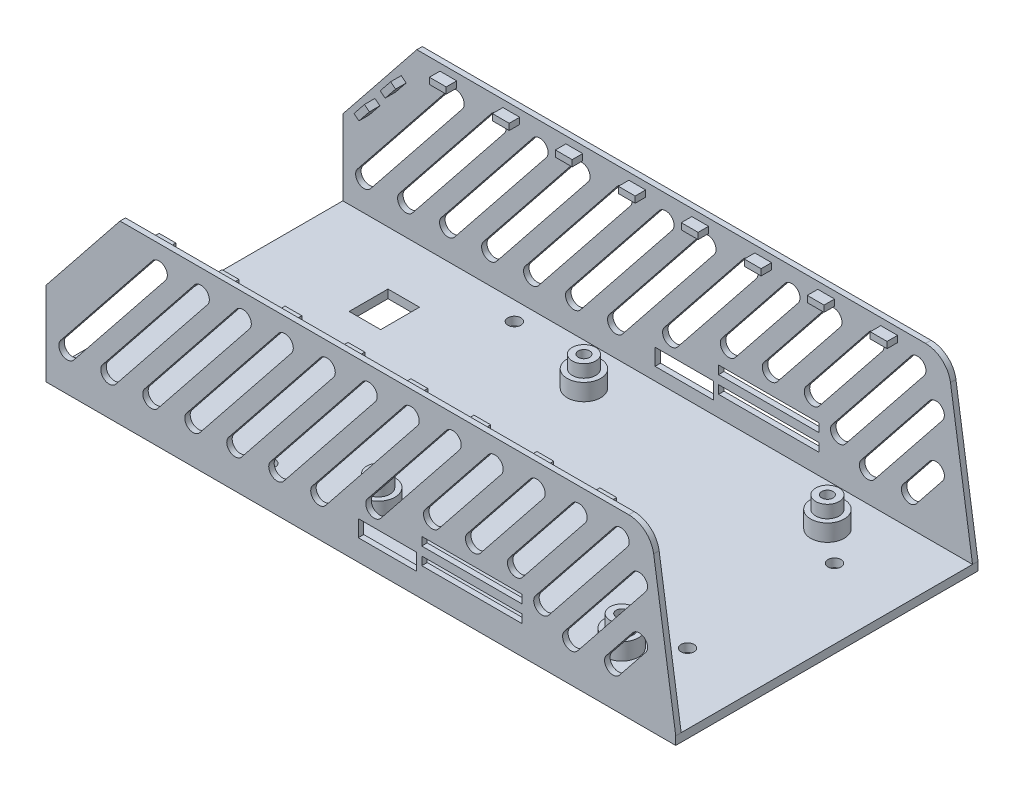
from build123d import *

# Parameters (mm, degrees)
SKETCH_1_W               = 150
SKETCH_1_H               = 72
EXTRUDE_353_DEPTH        = 2
SKETCH_2_R               = 4
EXTRUDE_552_DEPTH        = 7
CUT_EXTRUDE_M2_5_DEPTH   = 5
CUT_EXTRUDE_M2_5_2_REACH = 135.916
SKETCH_4_R               = 1.35
CUT_EXTRUDE_START        = -3
SKETCH_6_R               = 4
SKETCH_6_R_2             = 2.794428219
CUT_EXTRUDE_3_DEPTH      = 3
SKETCH_1271_W            = 23.879073069
SKETCH_1271_H            = 2
SKETCH_1271_W_2          = 13.873866224
SKETCH_1271_H_2          = 3.944574251
EXTRUDE_2203_DEPTH       = 1.3
SKETCH_14_W              = 4
SKETCH_14_H              = 1.5
EXTRUDE_2776_DEPTH       = 2.5
SKETCH_17_W              = 7.5
SKETCH_17_H              = 9.25
SKETCH_17_R              = 1.55
CUT_EXTRUDE_3993_DEPTH   = 2.5


with BuildPart() as part:
    # 草图1 → Extrude 353 (new body)
    with BuildSketch(Plane(origin=(0, 0, 0), x_dir=(1, 0, 0), z_dir=(0, 1, 0))):
        with Locations((36.41172395, 38.133946477)):
            Rectangle(SKETCH_1_W, SKETCH_1_H)
    extrude(amount=-EXTRUDE_353_DEPTH)

    # 草图2 → Extrude 552 (add)
    with BuildSketch(Plane(origin=(0, 0, 0), x_dir=(1, 0, 0), z_dir=(0, 1, 0))):
        with Locations((28.75484872, 13.928985193)):
            Circle(SKETCH_2_R)
        with Locations((86.75484872, 13.928985193)):
            Circle(SKETCH_2_R)
        with Locations((86.75484872, 62.928985193)):
            Circle(SKETCH_2_R)
        with Locations((28.75484872, 62.928985193)):
            Circle(SKETCH_2_R)
    extrude(amount=EXTRUDE_552_DEPTH)

    # Sketch 597 → Cut-Extrude m2.5 (cut)
    with BuildSketch(Plane.XZ.offset(2)):
        Polygon((88.785171308, -11.717396732), (85.854718224, -11.064880023), (83.824395636, -13.276468484), (84.724526132, -16.140573654), (87.654979216, -16.793090363), (89.685301804, -14.581501902), align=None)
        Polygon((30.785171308, -11.717396732), (27.854718224, -11.064880023), (25.824395636, -13.276468484), (26.724526132, -16.140573654), (29.654979216, -16.793090363), (31.685301804, -14.581501902), align=None)
        Polygon((88.785171308, -60.717396732), (85.854718224, -60.064880023), (83.824395636, -62.276468484), (84.724526132, -65.140573654), (87.654979216, -65.793090363), (89.685301804, -63.581501902), align=None)
        Polygon((30.785171308, -60.717396732), (27.854718224, -60.064880023), (25.824395636, -62.276468484), (26.724526132, -65.140573654), (29.654979216, -65.793090363), (31.685301804, -63.581501902), align=None)
    extrude(amount=-CUT_EXTRUDE_M2_5_DEPTH, mode=Mode.SUBTRACT)

    # 草图4 → Cut-Extrude m2.5 2 (cut, up to next)
    with BuildSketch(Plane.XZ.offset(-3), mode=Mode.PRIVATE) as cut_extrude_m2_5_2_sk1:
        with Locations((28.75484872, -13.928985193)):
            Circle(SKETCH_4_R)
    cut_extrude_m2_5_2_tool1 = extrude(cut_extrude_m2_5_2_sk1.sketch, amount=-CUT_EXTRUDE_M2_5_2_REACH, mode=Mode.PRIVATE) & part.part
    # 草图4 → Cut-Extrude m2.5 2 (cut, up to next)
    with BuildSketch(Plane.XZ.offset(-3), mode=Mode.PRIVATE) as cut_extrude_m2_5_2_sk2:
        with Locations((86.75484872, -13.928985193)):
            Circle(SKETCH_4_R)
    cut_extrude_m2_5_2_tool2 = extrude(cut_extrude_m2_5_2_sk2.sketch, amount=-CUT_EXTRUDE_M2_5_2_REACH, mode=Mode.PRIVATE) & part.part
    # 草图4 → Cut-Extrude m2.5 2 (cut, up to next)
    with BuildSketch(Plane.XZ.offset(-3), mode=Mode.PRIVATE) as cut_extrude_m2_5_2_sk3:
        with Locations((86.75484872, -62.928985193)):
            Circle(SKETCH_4_R)
    cut_extrude_m2_5_2_tool3 = extrude(cut_extrude_m2_5_2_sk3.sketch, amount=-CUT_EXTRUDE_M2_5_2_REACH, mode=Mode.PRIVATE) & part.part
    # 草图4 → Cut-Extrude m2.5 2 (cut, up to next)
    with BuildSketch(Plane.XZ.offset(-3), mode=Mode.PRIVATE) as cut_extrude_m2_5_2_sk4:
        with Locations((28.75484872, -62.928985193)):
            Circle(SKETCH_4_R)
    cut_extrude_m2_5_2_tool4 = extrude(cut_extrude_m2_5_2_sk4.sketch, amount=-CUT_EXTRUDE_M2_5_2_REACH, mode=Mode.PRIVATE) & part.part
    add(cut_extrude_m2_5_2_tool1.solids().sort_by_distance((28.754849, 3, -13.928985))[0], mode=Mode.SUBTRACT)
    add(cut_extrude_m2_5_2_tool2.solids().sort_by_distance((86.754849, 3, -13.928985))[0], mode=Mode.SUBTRACT)
    add(cut_extrude_m2_5_2_tool3.solids().sort_by_distance((86.754849, 3, -62.928985))[0], mode=Mode.SUBTRACT)
    add(cut_extrude_m2_5_2_tool4.solids().sort_by_distance((28.754849, 3, -62.928985))[0], mode=Mode.SUBTRACT)

    # 草图6 → 切除-拉伸3 (cut)
    # profile 1 of 4: a face of its own
    with BuildSketch(Plane(origin=(0, 7, 0), x_dir=(1, 0, 0), z_dir=(0, 1, 0)).offset(CUT_EXTRUDE_START)):
        with Locations((28.75484872, 13.928985193)):
            Circle(SKETCH_6_R)
        with Locations((28.75484872, 13.928985193)):
            Circle(SKETCH_6_R_2, mode=Mode.SUBTRACT)
    # profile 2 of 4: a face of its own
    with BuildSketch(Plane(origin=(0, 7, 0), x_dir=(1, 0, 0), z_dir=(0, 1, 0)).offset(CUT_EXTRUDE_START)):
        with Locations((86.75484872, 13.928985193)):
            Circle(SKETCH_6_R)
        with Locations((86.75484872, 13.928985193)):
            Circle(SKETCH_6_R_2, mode=Mode.SUBTRACT)
    # profile 3 of 4: a face of its own
    with BuildSketch(Plane(origin=(0, 7, 0), x_dir=(1, 0, 0), z_dir=(0, 1, 0)).offset(CUT_EXTRUDE_START)):
        with Locations((86.75484872, 62.928985193)):
            Circle(SKETCH_6_R)
        with Locations((86.75484872, 62.928985193)):
            Circle(SKETCH_6_R_2, mode=Mode.SUBTRACT)
    # profile 4 of 4: a face of its own
    with BuildSketch(Plane(origin=(0, 7, 0), x_dir=(1, 0, 0), z_dir=(0, 1, 0)).offset(CUT_EXTRUDE_START)):
        with Locations((28.75484872, 62.928985193)):
            Circle(SKETCH_6_R)
        with Locations((28.75484872, 62.928985193)):
            Circle(SKETCH_6_R_2, mode=Mode.SUBTRACT)
    extrude(amount=CUT_EXTRUDE_3_DEPTH, mode=Mode.SUBTRACT)

    # Sketch 1271 → Extrude 2203 (add)
    with BuildSketch(Plane(origin=(0, 0, -74.133946477), x_dir=(-1, 0, 0), z_dir=(0, 0, -1))):
        with BuildLine():
            Line((-111.41172395, 0), (38.58827605, 0))
            Line((38.58827605, 0), (38.58827605, 17.944664202))
            Line((38.58827605, 17.944664202), (20.958907586, 40))
            Line((20.958907586, 40), (-100.225410385, 40))
            ThreePointArc((-100.225410385, 40), (-104.139525694, 38.547493963), (-106.158548965, 34.893233782))
            Line((-106.158548965, 34.893233782), (-111.41172395, 0))
        make_face()
        with Locations((-62.854810914, 5.838076596)):
            Rectangle(SKETCH_1271_W, SKETCH_1271_H, mode=Mode.SUBTRACT)
        with Locations((-62.854810914, 9.895875112)):
            Rectangle(SKETCH_1271_W, SKETCH_1271_H, mode=Mode.SUBTRACT)
        with Locations((-42.731701964, 5.027712875)):
            Rectangle(SKETCH_1271_W_2, SKETCH_1271_H_2, mode=Mode.SUBTRACT)
        with BuildLine():
            Line((31.975272266, 5.823111001), (10.122209654, 33.162526768))
            ThreePointArc((10.122209654, 33.162526768), (10.435715549, 35.973525532), (13.246714313, 35.660019638))
            Line((13.246714313, 35.660019638), (35.099776925, 8.320603871))
            ThreePointArc((35.099776925, 8.320603871), (34.786271031, 5.509605106), (31.975272266, 5.823111001))
        make_face(mode=Mode.SUBTRACT)
        with BuildLine():
            Line((21.975272266, 5.823111001), (0.122209654, 33.162526768))
            ThreePointArc((0.122209654, 33.162526768), (0.435715549, 35.973525532), (3.246714313, 35.660019638))
            Line((3.246714313, 35.660019638), (25.099776925, 8.320603871))
            ThreePointArc((25.099776925, 8.320603871), (24.786271031, 5.509605106), (21.975272266, 5.823111001))
        make_face(mode=Mode.SUBTRACT)
        with BuildLine():
            Line((11.975272266, 5.823111001), (-9.877790346, 33.162526768))
            ThreePointArc((-9.877790346, 33.162526768), (-9.564284451, 35.973525532), (-6.753285687, 35.660019638))
            Line((-6.753285687, 35.660019638), (15.099776925, 8.320603871))
            ThreePointArc((15.099776925, 8.320603871), (14.786271031, 5.509605106), (11.975272266, 5.823111001))
        make_face(mode=Mode.SUBTRACT)
        with BuildLine():
            Line((1.975272266, 5.823111001), (-19.877790346, 33.162526768))
            ThreePointArc((-19.877790346, 33.162526768), (-19.564284451, 35.973525532), (-16.753285687, 35.660019638))
            Line((-16.753285687, 35.660019638), (5.099776925, 8.320603871))
            ThreePointArc((5.099776925, 8.320603871), (4.786271031, 5.509605106), (1.975272266, 5.823111001))
        make_face(mode=Mode.SUBTRACT)
        with BuildLine():
            Line((-8.024727734, 5.823111001), (-29.877790346, 33.162526768))
            ThreePointArc((-29.877790346, 33.162526768), (-29.564284451, 35.973525532), (-26.753285687, 35.660019638))
            Line((-26.753285687, 35.660019638), (-4.900223075, 8.320603871))
            ThreePointArc((-4.900223075, 8.320603871), (-5.213728969, 5.509605106), (-8.024727734, 5.823111001))
        make_face(mode=Mode.SUBTRACT)
        with BuildLine():
            Line((-18.024727734, 5.823111001), (-39.877790346, 33.162526768))
            ThreePointArc((-39.877790346, 33.162526768), (-39.564284451, 35.973525532), (-36.753285687, 35.660019638))
            Line((-36.753285687, 35.660019638), (-14.900223075, 8.320603871))
            ThreePointArc((-14.900223075, 8.320603871), (-15.213728969, 5.509605106), (-18.024727734, 5.823111001))
        make_face(mode=Mode.SUBTRACT)
        with BuildLine():
            Line((-28.024727734, 5.823111001), (-49.877790346, 33.162526768))
            ThreePointArc((-49.877790346, 33.162526768), (-49.564284451, 35.973525532), (-46.753285687, 35.660019638))
            Line((-46.753285687, 35.660019638), (-24.900223075, 8.320603871))
            ThreePointArc((-24.900223075, 8.320603871), (-25.213728969, 5.509605106), (-28.024727734, 5.823111001))
        make_face(mode=Mode.SUBTRACT)
        with BuildLine():
            Line((-41.146593821, 9.728741825), (-59.877790346, 33.162526768))
            ThreePointArc((-59.877790346, 33.162526768), (-59.564284451, 35.973525532), (-56.753285687, 35.660019638))
            Line((-56.753285687, 35.660019638), (-38.022089162, 12.226234695))
            ThreePointArc((-38.022089162, 12.226234695), (-38.335595057, 9.41523593), (-41.146593821, 9.728741825))
        make_face(mode=Mode.SUBTRACT)
        with BuildLine():
            Line((-54.892833126, 14.415498813), (-69.877790346, 33.162526768))
            ThreePointArc((-69.877790346, 33.162526768), (-69.564284451, 35.973525532), (-66.753285687, 35.660019638))
            Line((-66.753285687, 35.660019638), (-51.768328467, 16.912991683))
            ThreePointArc((-51.768328467, 16.912991683), (-52.081834362, 14.101992919), (-54.892833126, 14.415498813))
        make_face(mode=Mode.SUBTRACT)
        with BuildLine():
            Line((-64.892833126, 14.415498813), (-79.877790346, 33.162526768))
            ThreePointArc((-79.877790346, 33.162526768), (-79.564284451, 35.973525532), (-76.753285687, 35.660019638))
            Line((-76.753285687, 35.660019638), (-61.768328467, 16.912991683))
            ThreePointArc((-61.768328467, 16.912991683), (-62.081834362, 14.101992919), (-64.892833126, 14.415498813))
        make_face(mode=Mode.SUBTRACT)
        with BuildLine():
            Line((-74.892833126, 14.415498813), (-89.877790346, 33.162526768))
            ThreePointArc((-89.877790346, 33.162526768), (-89.564284451, 35.973525532), (-86.753285687, 35.660019638))
            Line((-86.753285687, 35.660019638), (-71.768328467, 16.912991683))
            ThreePointArc((-71.768328467, 16.912991683), (-72.081834362, 14.101992919), (-74.892833126, 14.415498813))
        make_face(mode=Mode.SUBTRACT)
        with BuildLine():
            Line((-81.146593821, 9.728741825), (-99.877790346, 33.162526768))
            ThreePointArc((-99.877790346, 33.162526768), (-99.564284451, 35.973525532), (-96.753285687, 35.660019638))
            Line((-96.753285687, 35.660019638), (-78.022089162, 12.226234695))
            ThreePointArc((-78.022089162, 12.226234695), (-78.335595057, 9.41523593), (-81.146593821, 9.728741825))
        make_face(mode=Mode.SUBTRACT)
        with BuildLine():
            Line((-88.024727734, 5.823111001), (-104.258431388, 26.132391285))
            ThreePointArc((-104.258431388, 26.132391285), (-103.944925494, 28.943390049), (-101.133926729, 28.629884155))
            Line((-101.133926729, 28.629884155), (-84.900223075, 8.320603871))
            ThreePointArc((-84.900223075, 8.320603871), (-85.213728969, 5.509605106), (-88.024727734, 5.823111001))
        make_face(mode=Mode.SUBTRACT)
        with BuildLine():
            Line((-98.024727734, 5.823111001), (-104.268459909, 13.634372649))
            ThreePointArc((-104.268459909, 13.634372649), (-103.954954014, 16.445371413), (-101.143955249, 16.131865519))
            Line((-101.143955249, 16.131865519), (-94.900223075, 8.320603871))
            ThreePointArc((-94.900223075, 8.320603871), (-95.213728969, 5.509605106), (-98.024727734, 5.823111001))
        make_face(mode=Mode.SUBTRACT)
    extrude_2203 = extrude(amount=-EXTRUDE_2203_DEPTH)

    # 草图14 → Extrude 2776 (add)
    with BuildSketch(Plane.XY.offset(-72.833946477)):
        Polygon((-30.926248063, 24.967724149), (-33.423740933, 21.84321949), (-32.252051685, 20.906659664), (-29.754558815, 24.031164323), align=None)
        Polygon((-24.682515888, 32.778985797), (-27.180008758, 29.654481138), (-26.00831951, 28.717921311), (-23.51082664, 31.84242597), align=None)
        with Locations((-13.454380934, 37.57)):
            Rectangle(SKETCH_14_W, SKETCH_14_H)
        with Locations((1.545619066, 37.57)):
            Rectangle(SKETCH_14_W, SKETCH_14_H)
        with Locations((16.545619066, 37.57)):
            Rectangle(SKETCH_14_W, SKETCH_14_H)
        with Locations((31.545619066, 37.57)):
            Rectangle(SKETCH_14_W, SKETCH_14_H)
        with Locations((46.545619066, 37.57)):
            Rectangle(SKETCH_14_W, SKETCH_14_H)
        with Locations((61.545619066, 37.57)):
            Rectangle(SKETCH_14_W, SKETCH_14_H)
        with Locations((76.545619066, 37.57)):
            Rectangle(SKETCH_14_W, SKETCH_14_H)
        with Locations((91.545619066, 37.57)):
            Rectangle(SKETCH_14_W, SKETCH_14_H)
    extrude_2776 = extrude(amount=EXTRUDE_2776_DEPTH)

    # 镜向1: Extrude 2203, Extrude 2776 across plane
    add(extrude_2203.mirror(Plane(origin=(0, 0, -38.133946477), x_dir=(1, 0, 0), z_dir=(0, 0, -1))))
    add(extrude_2776.mirror(Plane(origin=(0, 0, -38.133946477), x_dir=(1, 0, 0), z_dir=(0, 0, -1))))

    # 草图17 → Cut-Extrude 3993 (cut)
    with BuildSketch(Plane.XZ.offset(2)):
        with Locations((-11.268241823, -55.398909551)):
            Rectangle(SKETCH_17_W, SKETCH_17_H)
        with Locations((6.731758177, -68.373909551)):
            Circle(SKETCH_17_R)
        with Locations((94.731758177, -56.623909551)):
            Circle(SKETCH_17_R)
        with Locations((94.731758177, -21.623909551)):
            Circle(SKETCH_17_R)
        with Locations((6.731758177, -9.873909551)):
            Circle(SKETCH_17_R)
    extrude(amount=-CUT_EXTRUDE_3993_DEPTH, mode=Mode.SUBTRACT)


solid = part.part
